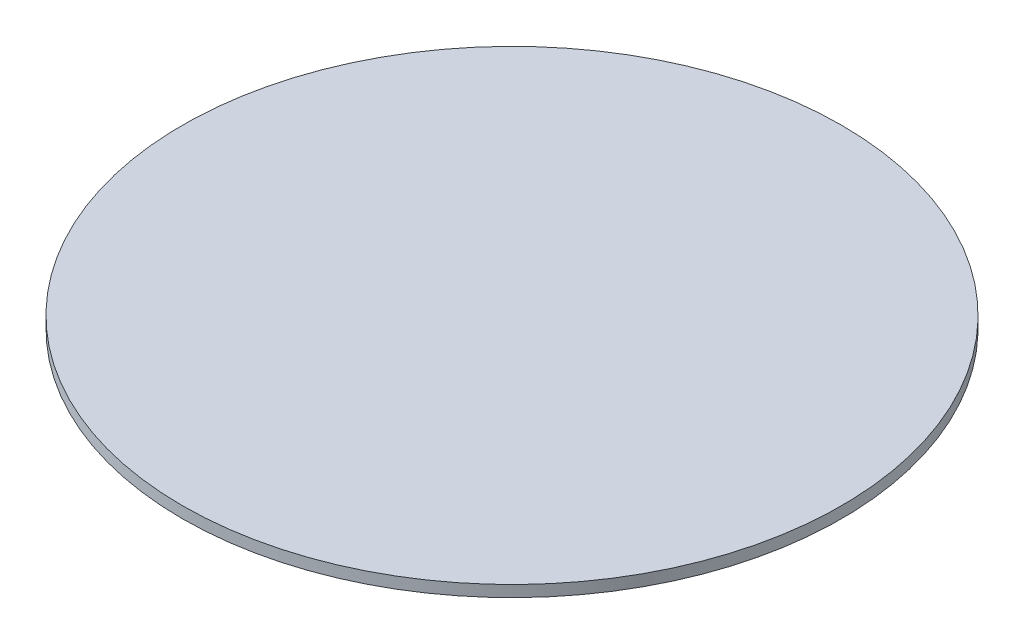
from build123d import *

# Parameters (mm, degrees)
SKETCH1_R           = 92.075
BOSS_EXTRUDE1_DEPTH = 3.175


with BuildPart() as part:
    # Sketch1 → Boss-Extrude1 (new body)
    with BuildSketch(Plane(origin=(0, 0, 0), x_dir=(1, 0, 0), z_dir=(0, 1, 0))):
        Circle(SKETCH1_R)
    extrude(amount=BOSS_EXTRUDE1_DEPTH)


solid = part.part
